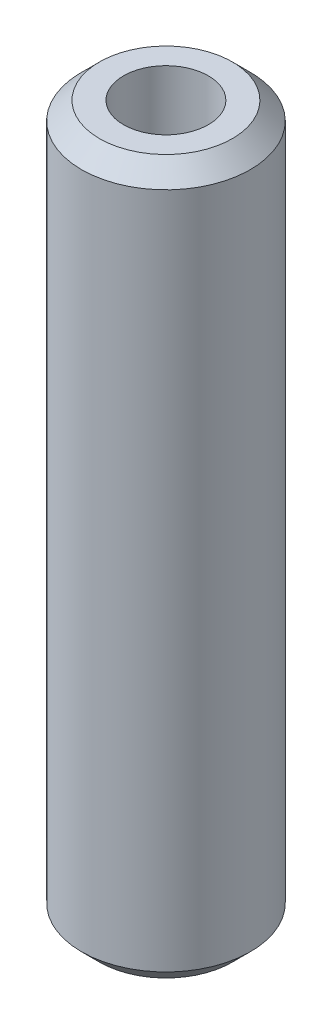
from build123d import *

# Parameters (mm, degrees)
SKETCH1_R           = 20
BOSS_EXTRUDE1_DEPTH = 169.041992605
SKETCH2_R           = 10.049806646
CUT_EXTRUDE1_DEPTH  = 172.391934652
CHAMFER1_SIZE       = 4.246085219


with BuildPart() as part:
    # Sketch1 → Boss-Extrude1 (new body)
    with BuildSketch(Plane(origin=(0, 0, 0), x_dir=(1, 0, 0), z_dir=(0, 1, 0))):
        Circle(SKETCH1_R)
    extrude(amount=BOSS_EXTRUDE1_DEPTH)

    # Sketch2 → Cut-Extrude1 (cut, through all)
    with BuildSketch(Plane(origin=(0, 0, 0), x_dir=(1, 0, 0), z_dir=(0, 1, 0))):
        Circle(SKETCH2_R)
    extrude(amount=CUT_EXTRUDE1_DEPTH, mode=Mode.SUBTRACT)

    # Chamfer1
    chamfer1_edges = [part.edges().sort_by_distance(p)[0] for p in [
        (-20, 169.041992605, 0),
        (-20, 0, 0),
    ]]
    chamfer(chamfer1_edges, length=CHAMFER1_SIZE)


solid = part.part
